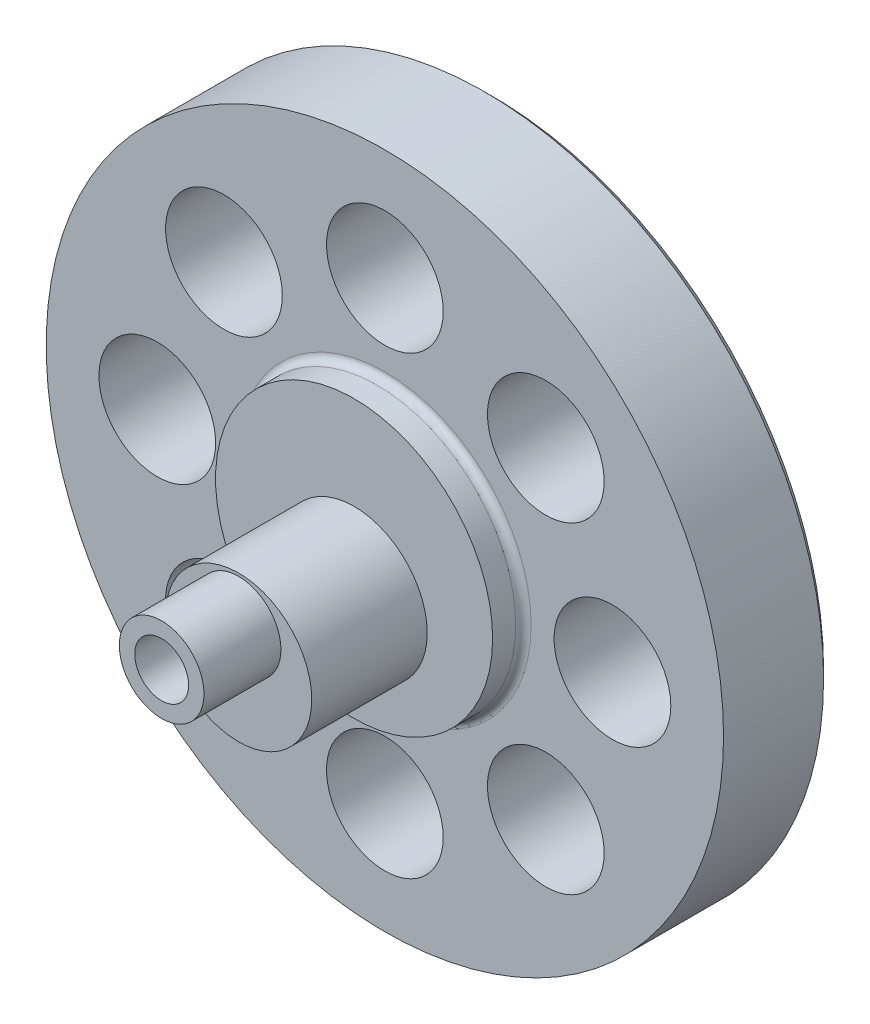
from build123d import *

# Parameters (mm, degrees)
SKETCH1_R           = 22
SKETCH1_R_2         = 3.79
BOSS_EXTRUDE1_DEPTH = 7
SKETCH2_R           = 9
BOSS_EXTRUDE2_DEPTH = 2
SKETCH3_R           = 6.75
CUT_EXTRUDE1_DEPTH  = 7
SKETCH4_R           = 4.75
BOSS_EXTRUDE3_DEPTH = 7.5
SKETCH5_R           = 2.75
BOSS_EXTRUDE4_DEPTH = 5
FILLET1_R           = 0.5
CHAMFER1_SIZE       = 0.5
SKETCH7_R           = 1.75
CUT_EXTRUDE2_DEPTH  = 15


with BuildPart() as part:
    # Sketch1 → Boss-Extrude1 (new body)
    with BuildSketch(Plane.XY):
        Circle(SKETCH1_R)
        with Locations((-14.783956386, 0)):
            Circle(SKETCH1_R_2, mode=Mode.SUBTRACT)
        with Locations((-10.453835814, -10.453835814)):
            Circle(SKETCH1_R_2, mode=Mode.SUBTRACT)
        with Locations((0, -14.783956386)):
            Circle(SKETCH1_R_2, mode=Mode.SUBTRACT)
        with Locations((10.453835814, -10.453835814)):
            Circle(SKETCH1_R_2, mode=Mode.SUBTRACT)
        with Locations((14.783956386, 0)):
            Circle(SKETCH1_R_2, mode=Mode.SUBTRACT)
        with Locations((10.453835814, 10.453835814)):
            Circle(SKETCH1_R_2, mode=Mode.SUBTRACT)
        with Locations((0, 14.783956386)):
            Circle(SKETCH1_R_2, mode=Mode.SUBTRACT)
        with Locations((-10.453835814, 10.453835814)):
            Circle(SKETCH1_R_2, mode=Mode.SUBTRACT)
    extrude(amount=BOSS_EXTRUDE1_DEPTH)

    # Sketch2 → Boss-Extrude2 (add)
    with BuildSketch(Plane.XY.offset(7)):
        Circle(SKETCH2_R)
    extrude(amount=BOSS_EXTRUDE2_DEPTH)

    # Sketch3 → Cut-Extrude1 (cut)
    with BuildSketch(Plane(origin=(0, 0, 0), x_dir=(-1, 0, 0), z_dir=(0, 0, -1))):
        Circle(SKETCH3_R)
    extrude(amount=-CUT_EXTRUDE1_DEPTH, mode=Mode.SUBTRACT)

    # Sketch4 → Boss-Extrude3 (add)
    with BuildSketch(Plane.XY.offset(9)):
        with Locations((0, -1.812)):
            Circle(SKETCH4_R)
    extrude(amount=BOSS_EXTRUDE3_DEPTH)

    # Sketch5 → Boss-Extrude4 (add)
    with BuildSketch(Plane.XY.offset(16.5)):
        Circle(SKETCH5_R)
    extrude(amount=BOSS_EXTRUDE4_DEPTH)

    # Fillet1
    fillet1_edges = [part.edges().sort_by_distance(p)[0] for p in [
        (-9, 0, 7),
    ]]
    fillet(fillet1_edges, radius=FILLET1_R)

    # Chamfer1
    chamfer1_edges = [part.edges().sort_by_distance(p)[0] for p in [
        (-14.243835814, 10.453835814, 0),
        (-3.79, 14.783956386, 0),
        (6.663835814, 10.453835814, 0),
        (10.993956386, 0, 0),
        (6.663835814, -10.453835814, 0),
        (-3.79, -14.783956386, 0),
        (-14.243835814, -10.453835814, 0),
        (-18.573956386, 0, 0),
        (-22, 0, 0),
        (6.75, 0, 0),
    ]]
    chamfer(chamfer1_edges, length=CHAMFER1_SIZE)

    # Sketch7 → Cut-Extrude2 (cut)
    with BuildSketch(Plane.XY.offset(21.5)):
        Circle(SKETCH7_R)
    extrude(amount=-CUT_EXTRUDE2_DEPTH, mode=Mode.SUBTRACT)


solid = part.part
